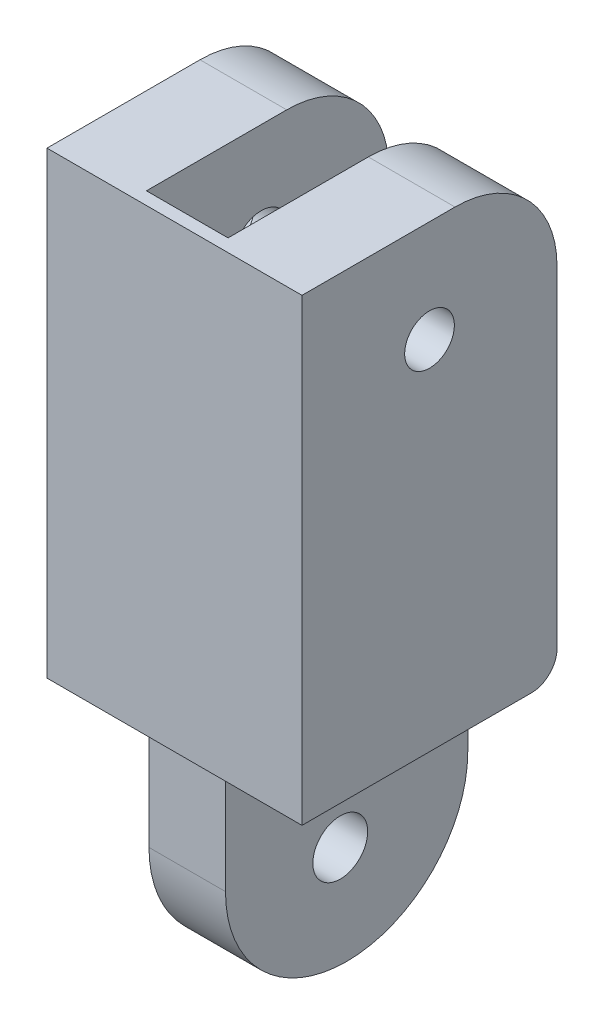
from build123d import *

# Parameters (mm, degrees)
BOSS_EXTRU_1_DEPTH      = 10
ESQUISSE4_R             = 0.975
ENL_V_MAT_EXTRU_3_DEPTH = 10
ENL_V_MAT_EXTRU_4_DEPTH = 1.6
CONG_4_R                = 0.3
ESQUISSE6_R             = 1.075
ENL_V_MAT_EXTRU_5_DEPTH = 22.592822882
CONG_5_R                = 4
CONG_6_R                = 1
ENL_V_MAT_EXTRU_6_REACH = 24.891
ESQUISSE7_R             = 1.075
ESQUISSE8_R             = 1.925
ENL_V_MAT_EXTRU_7_DEPTH = 2.05


with BuildPart() as part:
    # Esquisse1 → Boss.-Extru.1 (new body)
    with BuildSketch(Plane.XY):
        Polygon((-5, 9), (-5, -9), (-1.5, -9), (-1.5, -18), (1.5, -18), (1.5, -9), (5, -9), (5, 9), align=None)
    extrude(amount=BOSS_EXTRU_1_DEPTH)

    # Esquisse4 → Enlèv. mat.-Extru.3 (cut)
    with BuildSketch(Plane.ZY.offset(5)):
        with Locations((5, 5)):
            Circle(ESQUISSE4_R)
    extrude(amount=-ENL_V_MAT_EXTRU_3_DEPTH, mode=Mode.SUBTRACT)

    # Esquisse5 → Enlèv. mat.-Extru.4 (cut, symmetric)
    with BuildSketch(Plane(origin=(0, 0, 0), x_dir=(0, 0, -1), z_dir=(1, 0, 0))):
        with BuildLine():
            Line((0, 9), (-9.5, 9))
            Line((-9.5, 9), (-9.5, 4))
            ThreePointArc((-9.5, 4), (-4.75, -0.75), (0, 4))
            Line((0, 4), (0, 9))
        make_face()
    extrude(amount=ENL_V_MAT_EXTRU_4_DEPTH, both=True, mode=Mode.SUBTRACT)

    # Congé4
    cong_4_edges = [part.edges().sort_by_distance(p)[0] for p in [
        (0, 4, 0),
    ]]
    fillet(cong_4_edges, radius=CONG_4_R)

    # Esquisse6 → Enlèv. mat.-Extru.5 (cut, through all)
    with BuildSketch(Plane(origin=(1.5, 0, 0), x_dir=(0, 0, -1), z_dir=(1, 0, 0))):
        with BuildLine():
            Line((-9.5, -9), (-10, -9))
            Line((-10, -9), (-10, -18))
            Line((-10, -18), (-4.75, -18))
            ThreePointArc((-4.75, -18), (-8.108757211, -16.608757211), (-9.5, -13.25))
            Line((-9.5, -13.25), (-9.5, -9))
        make_face()
        with BuildLine():
            ThreePointArc((0, -13.25), (-1.391242789, -16.608757211), (-4.75, -18))
            Line((-4.75, -18), (0, -18))
            Line((0, -18), (0, -13.25))
        make_face()
        with Locations((-5, -14)):
            Circle(ESQUISSE6_R)
    extrude(amount=-ENL_V_MAT_EXTRU_5_DEPTH, mode=Mode.SUBTRACT)

    # Congé5
    cong_5_edges = [part.edges().sort_by_distance(p)[0] for p in [
        (-3.3, 9, 0),
        (3.3, 9, 0),
    ]]
    fillet(cong_5_edges, radius=CONG_5_R)

    # Congé6
    cong_6_edges = [part.edges().sort_by_distance(p)[0] for p in [
        (-3.25, -9, 0),
        (3.25, -9, 0),
    ]]
    fillet(cong_6_edges, radius=CONG_6_R)

    # Esquisse7 → Enlèv. mat.-Extru.6 (cut, up to next)
    with BuildSketch(Plane.ZY.offset(5), mode=Mode.PRIVATE) as enl_v_mat_extru_6_sk1:
        with Locations((5, 5)):
            Circle(ESQUISSE7_R)
    enl_v_mat_extru_6_tool1 = extrude(enl_v_mat_extru_6_sk1.sketch, amount=-ENL_V_MAT_EXTRU_6_REACH, mode=Mode.PRIVATE) & part.part
    add(enl_v_mat_extru_6_tool1.solids().sort_by_distance((-5, 5, 5))[0], mode=Mode.SUBTRACT)

    # Esquisse8 → Enlèv. mat.-Extru.7 (cut)
    with BuildSketch(Plane.ZY.offset(5)):
        with Locations((5, 5)):
            Circle(ESQUISSE8_R)
    extrude(amount=-ENL_V_MAT_EXTRU_7_DEPTH, mode=Mode.SUBTRACT)


solid = part.part
